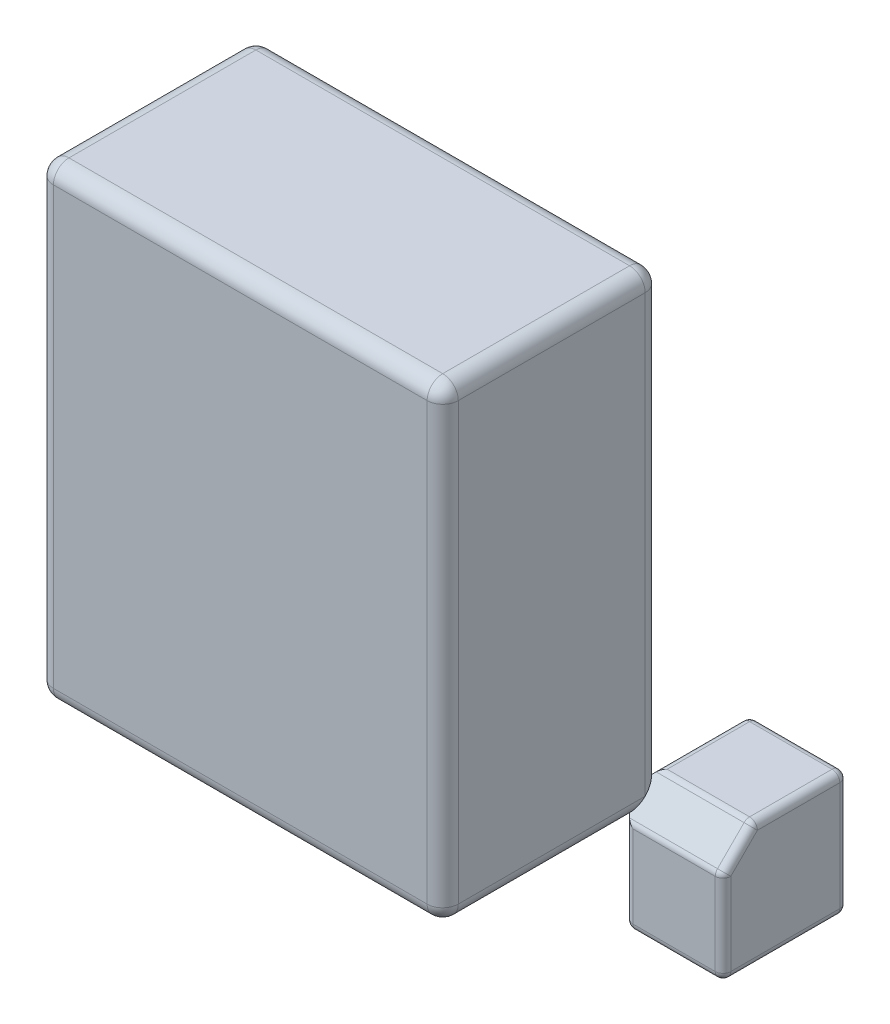
from build123d import *

# Parameters (mm, degrees)
SKETCH1_W                = 26
SKETCH1_H                = 30
BOSS_EXTRUDE1_DEPTH      = 14
SHELL1_T                 = 1
BOSS_EXTRUDE3_DEPTH      = 6
BOSS_EXTRUDE3_DEPTH_BACK = 2
SKETCH2_W                = 8
SKETCH2_H                = 8
CHAMFER2_SIZE            = 2
FILLET1_R                = 1
FILLET2_R                = 0.5


with BuildPart() as part:
    # Sketch1 → Boss-Extrude1 (new body)
    with BuildSketch(Plane.XY):
        with Locations((13, 15)):
            Rectangle(SKETCH1_W, SKETCH1_H)
    extrude(amount=BOSS_EXTRUDE1_DEPTH)

    # Shell1 (no face opened: a closed hollow body)
    add(offset(amount=-SHELL1_T, mode=Mode.PRIVATE), mode=Mode.SUBTRACT)

    # Sketch2 → Boss-Extrude3 (add, two sides: drawn at the far end of the back side and taken through both)
    with BuildSketch(Plane(origin=(0, 0, 0), x_dir=(-1, 0, 0), z_dir=(0, 0, -1)).offset(-BOSS_EXTRUDE3_DEPTH_BACK)):
        with Locations((-28, -2)):
            Rectangle(SKETCH2_W, SKETCH2_H)
    extrude(amount=BOSS_EXTRUDE3_DEPTH + BOSS_EXTRUDE3_DEPTH_BACK)

    # Chamfer2
    chamfer2_edges = [part.edges().sort_by_distance(p)[0] for p in [
        (24, -3, 2),
        (24, 2, -3),
        (29, 2, 2),
    ]]
    chamfer(chamfer2_edges, length=CHAMFER2_SIZE)

    # Fillet1
    # the kernel refuses this fillet: 1 mm, written as the material it takes off along each edge
    with BuildSketch(Plane(origin=(1, 29, 1), x_dir=(0, 1, 0), z_dir=(0, 0, -1))) as fillet1_piece_1_section:
        Polygon((0, 0), (FILLET1_R, 0), (FILLET1_R, -FILLET1_R), (0, -FILLET1_R), align=None)
    fillet1_piece_1 = extrude(amount=FILLET1_R, mode=Mode.PRIVATE)
    fillet1_piece_1 = fillet1_piece_1 - Plane(origin=(1, 29, 1), x_dir=(0.7071067811865476, -0.7071067811865475, 0), z_dir=(0, 0, -1)) * Sphere(FILLET1_R, mode=Mode.PRIVATE)
    add(fillet1_piece_1, mode=Mode.SUBTRACT)
    with BuildSketch(Plane(origin=(1, 1, 1), x_dir=(0, 0, -1), z_dir=(0, -1, 0))) as fillet1_piece_2_section:
        Polygon((0, 0), (FILLET1_R, 0), (FILLET1_R, -FILLET1_R), (0, -FILLET1_R), align=None)
    fillet1_piece_2 = extrude(amount=FILLET1_R, mode=Mode.PRIVATE)
    fillet1_piece_2 = fillet1_piece_2 - Plane(origin=(1, 1, 1), x_dir=(0.7071067811865475, 0, 0.7071067811865475), z_dir=(0, -1, 0)) * Sphere(FILLET1_R, mode=Mode.PRIVATE)
    add(fillet1_piece_2, mode=Mode.SUBTRACT)
    with BuildSketch(Plane(origin=(25, 29, 1), x_dir=(0, 0, -1), z_dir=(0, 1, 0))) as fillet1_piece_3_section:
        Polygon((0, 0), (FILLET1_R, 0), (FILLET1_R, -FILLET1_R), (0, -FILLET1_R), align=None)
    fillet1_piece_3 = extrude(amount=FILLET1_R, mode=Mode.PRIVATE)
    fillet1_piece_3 = fillet1_piece_3 - Plane(origin=(25, 29, 1), x_dir=(-0.7071067811865475, 0, 0.7071067811865475), z_dir=(0, 1, 0)) * Sphere(FILLET1_R, mode=Mode.PRIVATE)
    add(fillet1_piece_3, mode=Mode.SUBTRACT)
    with BuildSketch(Plane(origin=(1, 1, 13), x_dir=(-1, 0, 0), z_dir=(0, -1, 0))) as fillet1_piece_4_section:
        Polygon((0, 0), (FILLET1_R, 0), (FILLET1_R, -FILLET1_R), (0, -FILLET1_R), align=None)
    fillet1_piece_4 = extrude(amount=FILLET1_R, mode=Mode.PRIVATE)
    fillet1_piece_4 = fillet1_piece_4 - Plane(origin=(1, 1, 13), x_dir=(0.7071067811865475, 0, -0.7071067811865475), z_dir=(0, -1, 0)) * Sphere(FILLET1_R, mode=Mode.PRIVATE)
    add(fillet1_piece_4, mode=Mode.SUBTRACT)
    with BuildSketch(Plane(origin=(25, 1, 13), x_dir=(1, 0, 0), z_dir=(0, -1, 0))) as fillet1_piece_5_section:
        Polygon((0, 0), (FILLET1_R, 0), (FILLET1_R, FILLET1_R), (0, FILLET1_R), align=None)
    fillet1_piece_5 = extrude(amount=FILLET1_R, mode=Mode.PRIVATE)
    fillet1_piece_5 = fillet1_piece_5 - Plane(origin=(25, 1, 13), x_dir=(-0.7071067811865475, 0, -0.7071067811865475), z_dir=(0, -1, 0)) * Sphere(FILLET1_R, mode=Mode.PRIVATE)
    add(fillet1_piece_5, mode=Mode.SUBTRACT)
    with BuildSketch(Plane(origin=(25, 29, 13), x_dir=(1, 0, 0), z_dir=(0, 1, 0))) as fillet1_piece_6_section:
        Polygon((0, 0), (FILLET1_R, 0), (FILLET1_R, -FILLET1_R), (0, -FILLET1_R), align=None)
    fillet1_piece_6 = extrude(amount=FILLET1_R, mode=Mode.PRIVATE)
    fillet1_piece_6 = fillet1_piece_6 - Plane(origin=(25, 29, 13), x_dir=(-0.7071067811865475, 0, -0.7071067811865475), z_dir=(0, 1, 0)) * Sphere(FILLET1_R, mode=Mode.PRIVATE)
    add(fillet1_piece_6, mode=Mode.SUBTRACT)
    with BuildSketch(Plane(origin=(1, 29, 13), x_dir=(-1, 0, 0), z_dir=(0, 1, 0))) as fillet1_piece_7_section:
        Polygon((0, 0), (FILLET1_R, 0), (FILLET1_R, FILLET1_R), (0, FILLET1_R), align=None)
    fillet1_piece_7 = extrude(amount=FILLET1_R, mode=Mode.PRIVATE)
    fillet1_piece_7 = fillet1_piece_7 - Plane(origin=(1, 29, 13), x_dir=(0.7071067811865475, 0, -0.7071067811865475), z_dir=(0, 1, 0)) * Sphere(FILLET1_R, mode=Mode.PRIVATE)
    add(fillet1_piece_7, mode=Mode.SUBTRACT)
    with BuildSketch(Plane(origin=(0, 29, 0), x_dir=(1, 0, 0), z_dir=(0, -1, 0)), Plane(origin=(26, 1, 14), x_dir=(0, 0, -1), z_dir=(0, 1, 0)), Plane(origin=(0, 29, 14), x_dir=(0, 0, -1), z_dir=(0, -1, 0))) as fillet1_piece_8:
        with BuildLine():
            CenterArc((FILLET1_R, FILLET1_R), FILLET1_R, 180, 90)
            Line((0, FILLET1_R), (0, 0))
            Line((0, 0), (FILLET1_R, 0))
        make_face()
    extrude(amount=28, mode=Mode.SUBTRACT)
    with BuildSketch(Plane(origin=(1, 0, 0), x_dir=(0, 0, 1), z_dir=(1, 0, 0))) as fillet1_piece_9_section:
        with BuildLine():
            CenterArc((FILLET1_R, -FILLET1_R), FILLET1_R, 90, 90)
            Line((0, -FILLET1_R), (0, 0))
            Line((0, 0), (FILLET1_R, 0))
        make_face()
    fillet1_piece_9 = extrude(amount=25.5, mode=Mode.PRIVATE)
    fillet1_piece_9 = split(fillet1_piece_9, bisect_by=Plane(origin=(18.381826638, 0.226414546, -5.618173362), z_dir=(-0.7071067811865476, 0, 0.7071067811865476)), keep=Keep.TOP, mode=Mode.PRIVATE)
    fillet1_piece_9 = split(fillet1_piece_9, bisect_by=Plane(origin=(18.381826638, -5.618173362, 0.226414546), z_dir=(-0.7071067811865476, 0.7071067811865476, 0)), keep=Keep.TOP, mode=Mode.PRIVATE)
    add(fillet1_piece_9, mode=Mode.SUBTRACT)
    with BuildSketch(Plane(origin=(1, 0, 0), x_dir=(0, 0, 1), z_dir=(1, 0, 0))) as fillet1_piece_10_section:
        with BuildLine():
            CenterArc((FILLET1_R, -FILLET1_R), FILLET1_R, 90, 90)
            Line((0, -FILLET1_R), (0, 0))
            Line((0, 0), (FILLET1_R, 0))
        make_face()
    fillet1_piece_10 = extrude(amount=25.5, mode=Mode.PRIVATE)
    fillet1_piece_10 = split(fillet1_piece_10, bisect_by=Plane(origin=(24.16446835, 0.528927527, 0.16446835), z_dir=(0.7071067811865476, 0, -0.7071067811865476)), keep=Keep.TOP, mode=Mode.PRIVATE)
    fillet1_piece_10 = split(fillet1_piece_10, bisect_by=Plane(origin=(24.407441135, 0.407441135, 0.042981958), z_dir=(-0.7071067811865476, 0.7071067811865476, 0)), keep=Keep.TOP, mode=Mode.PRIVATE)
    add(fillet1_piece_10, mode=Mode.SUBTRACT)
    with BuildSketch(Plane(origin=(1, 0, 0), x_dir=(0, 0, 1), z_dir=(1, 0, 0))) as fillet1_piece_11_section:
        with BuildLine():
            CenterArc((FILLET1_R, -FILLET1_R), FILLET1_R, 90, 90)
            Line((0, -FILLET1_R), (0, 0))
            Line((0, 0), (FILLET1_R, 0))
        make_face()
    fillet1_piece_11 = extrude(amount=25.5, mode=Mode.PRIVATE)
    fillet1_piece_11 = split(fillet1_piece_11, bisect_by=Plane(origin=(24.407441135, 0.042981958, 0.407441135), z_dir=(-0.7071067811865476, 0, 0.7071067811865476)), keep=Keep.TOP, mode=Mode.PRIVATE)
    fillet1_piece_11 = split(fillet1_piece_11, bisect_by=Plane(origin=(24.16446835, 0.16446835, 0.528927527), z_dir=(0.7071067811865476, -0.7071067811865476, 0)), keep=Keep.TOP, mode=Mode.PRIVATE)
    add(fillet1_piece_11, mode=Mode.SUBTRACT)
    with BuildSketch(Plane(origin=(26, -0.5, 0), x_dir=(-1, 0, 0), z_dir=(0, 1, 0))) as fillet1_piece_12_section:
        with BuildLine():
            CenterArc((FILLET1_R, FILLET1_R), FILLET1_R, 180, 90)
            Line((0, FILLET1_R), (0, 0))
            Line((0, 0), (FILLET1_R, 0))
        make_face()
    fillet1_piece_12 = extrude(amount=29.5, mode=Mode.PRIVATE)
    fillet1_piece_12 = split(fillet1_piece_12, bisect_by=Plane(origin=(25.83553165, 1.83553165, 0.528927527), z_dir=(0.7071067811865476, -0.7071067811865476, 0)), keep=Keep.TOP, mode=Mode.PRIVATE)
    fillet1_piece_12 = split(fillet1_piece_12, bisect_by=Plane(origin=(25.957018042, 1.592558865, 0.407441135), z_dir=(0, 0.7071067811865476, 0.7071067811865476)), keep=Keep.TOP, mode=Mode.PRIVATE)
    add(fillet1_piece_12, mode=Mode.SUBTRACT)
    with BuildSketch(Plane(origin=(26, -0.5, 0), x_dir=(-1, 0, 0), z_dir=(0, 1, 0))) as fillet1_piece_13_section:
        with BuildLine():
            CenterArc((FILLET1_R, FILLET1_R), FILLET1_R, 180, 90)
            Line((0, FILLET1_R), (0, 0))
            Line((0, 0), (FILLET1_R, 0))
        make_face()
    fillet1_piece_13 = extrude(amount=29.5, mode=Mode.PRIVATE)
    fillet1_piece_13 = split(fillet1_piece_13, bisect_by=Plane(origin=(25.592558865, 1.592558865, 0.042981958), z_dir=(-0.7071067811865476, 0.7071067811865476, 0)), keep=Keep.TOP, mode=Mode.PRIVATE)
    fillet1_piece_13 = split(fillet1_piece_13, bisect_by=Plane(origin=(25.471072473, 1.83553165, 0.16446835), z_dir=(0, -0.7071067811865476, -0.7071067811865476)), keep=Keep.TOP, mode=Mode.PRIVATE)
    add(fillet1_piece_13, mode=Mode.SUBTRACT)
    with BuildSketch(Plane(origin=(26, -0.5, 0), x_dir=(-1, 0, 0), z_dir=(0, 1, 0))) as fillet1_piece_14_section:
        with BuildLine():
            CenterArc((FILLET1_R, FILLET1_R), FILLET1_R, 180, 90)
            Line((0, FILLET1_R), (0, 0))
            Line((0, 0), (FILLET1_R, 0))
        make_face()
    fillet1_piece_14 = extrude(amount=29.5, mode=Mode.PRIVATE)
    fillet1_piece_14 = split(fillet1_piece_14, bisect_by=Plane(origin=(32.618183131, 8.618183131, 0.226411675), z_dir=(-0.7071067811865476, 0.7071067811865476, 0)), keep=Keep.TOP, mode=Mode.PRIVATE)
    fillet1_piece_14 = split(fillet1_piece_14, bisect_by=Plane(origin=(25.773588325, 8.618183131, -6.618183131), z_dir=(0, 0.7071067811865476, 0.7071067811865476)), keep=Keep.TOP, mode=Mode.PRIVATE)
    add(fillet1_piece_14, mode=Mode.SUBTRACT)
    with BuildSketch(Plane(origin=(25, 30, 0), x_dir=(0, -1, 0), z_dir=(-1, 0, 0)), Plane(origin=(1, 0, 14), x_dir=(0, 0, -1), z_dir=(1, 0, 0))) as fillet1_piece_15:
        with BuildLine():
            CenterArc((FILLET1_R, FILLET1_R), FILLET1_R, 180, 90)
            Line((0, FILLET1_R), (0, 0))
            Line((0, 0), (FILLET1_R, 0))
        make_face()
    extrude(amount=24, mode=Mode.SUBTRACT)
    with BuildSketch(Plane(origin=(25, 30, 14), x_dir=(0, -1, 0), z_dir=(-1, 0, 0))) as fillet1_piece_16:
        with BuildLine():
            CenterArc((FILLET1_R, -FILLET1_R), FILLET1_R, 90, 90)
            Line((0, -FILLET1_R), (0, 0))
            Line((0, 0), (FILLET1_R, 0))
        make_face()
    extrude(amount=24, mode=Mode.SUBTRACT)
    with BuildSketch(Plane(origin=(0, 30, 1), x_dir=(0, -1, 0), z_dir=(0, 0, 1)), Plane(origin=(0, 0, 1), x_dir=(1, 0, 0), z_dir=(0, 0, 1))) as fillet1_piece_17:
        with BuildLine():
            CenterArc((FILLET1_R, FILLET1_R), FILLET1_R, 180, 90)
            Line((0, FILLET1_R), (0, 0))
            Line((0, 0), (FILLET1_R, 0))
        make_face()
    extrude(amount=12, mode=Mode.SUBTRACT)
    with BuildSketch(Plane(origin=(26, 30, 1), x_dir=(0, -1, 0), z_dir=(0, 0, 1))) as fillet1_piece_18:
        with BuildLine():
            CenterArc((FILLET1_R, -FILLET1_R), FILLET1_R, 90, 90)
            Line((0, -FILLET1_R), (0, 0))
            Line((0, 0), (FILLET1_R, 0))
        make_face()
    extrude(amount=12, mode=Mode.SUBTRACT)
    with BuildSketch(Plane(origin=(26, 0, -0.5), x_dir=(-1, 0, 0), z_dir=(0, 0, 1))) as fillet1_piece_19_section:
        with BuildLine():
            CenterArc((FILLET1_R, -FILLET1_R), FILLET1_R, 90, 90)
            Line((0, -FILLET1_R), (0, 0))
            Line((0, 0), (FILLET1_R, 0))
        make_face()
    fillet1_piece_19 = extrude(amount=13.5, mode=Mode.PRIVATE)
    fillet1_piece_19 = split(fillet1_piece_19, bisect_by=Plane(origin=(25.83553165, 0.528927527, 1.83553165), z_dir=(0.7071067811865476, 0, -0.7071067811865476)), keep=Keep.TOP, mode=Mode.PRIVATE)
    fillet1_piece_19 = split(fillet1_piece_19, bisect_by=Plane(origin=(25.957018042, 0.407441135, 1.592558865), z_dir=(0, 0.7071067811865476, 0.7071067811865476)), keep=Keep.TOP, mode=Mode.PRIVATE)
    add(fillet1_piece_19, mode=Mode.SUBTRACT)
    with BuildSketch(Plane(origin=(26, 0, -0.5), x_dir=(-1, 0, 0), z_dir=(0, 0, 1))) as fillet1_piece_20_section:
        with BuildLine():
            CenterArc((FILLET1_R, -FILLET1_R), FILLET1_R, 90, 90)
            Line((0, -FILLET1_R), (0, 0))
            Line((0, 0), (FILLET1_R, 0))
        make_face()
    fillet1_piece_20 = extrude(amount=13.5, mode=Mode.PRIVATE)
    fillet1_piece_20 = split(fillet1_piece_20, bisect_by=Plane(origin=(25.592558865, 0.042981958, 1.592558865), z_dir=(-0.7071067811865476, 0, 0.7071067811865476)), keep=Keep.TOP, mode=Mode.PRIVATE)
    fillet1_piece_20 = split(fillet1_piece_20, bisect_by=Plane(origin=(25.471072473, 0.16446835, 1.83553165), z_dir=(0, -0.7071067811865476, -0.7071067811865476)), keep=Keep.TOP, mode=Mode.PRIVATE)
    add(fillet1_piece_20, mode=Mode.SUBTRACT)
    with BuildSketch(Plane(origin=(26, 0, -0.5), x_dir=(-1, 0, 0), z_dir=(0, 0, 1))) as fillet1_piece_21_section:
        with BuildLine():
            CenterArc((FILLET1_R, -FILLET1_R), FILLET1_R, 90, 90)
            Line((0, -FILLET1_R), (0, 0))
            Line((0, 0), (FILLET1_R, 0))
        make_face()
    fillet1_piece_21 = extrude(amount=13.5, mode=Mode.PRIVATE)
    fillet1_piece_21 = split(fillet1_piece_21, bisect_by=Plane(origin=(28.618101716, 0.226435602, 4.618101716), z_dir=(-0.7071067811865476, 0, 0.7071067811865476)), keep=Keep.TOP, mode=Mode.PRIVATE)
    fillet1_piece_21 = split(fillet1_piece_21, bisect_by=Plane(origin=(25.773564398, -2.618101716, 4.618101716), z_dir=(0, 0.7071067811865476, 0.7071067811865476)), keep=Keep.TOP, mode=Mode.PRIVATE)
    add(fillet1_piece_21, mode=Mode.SUBTRACT)

    # Fillet2
    fillet2_edges = [part.edges().sort_by_distance(p)[0] for p in [
        (28, -6, -6),
        (32, -6, -2),
        (32, -2, -6),
        (32, 2, -3),
        (29, 2, -6),
        (26, 2, -3),
        (29, 2, 0),
        (32, -3, 2),
        (32, 1, 1),
        (29, -6, 2),
        (26, -3, 2),
        (29, 0, 2),
        (24, -3, -6),
        (24, -6, -3),
        (24, -3, 0),
        (24, 0, -3),
        (25, 1, -6),
        (25, -6, 1),
    ]]
    fillet(fillet2_edges, radius=FILLET2_R)


solid = part.part
